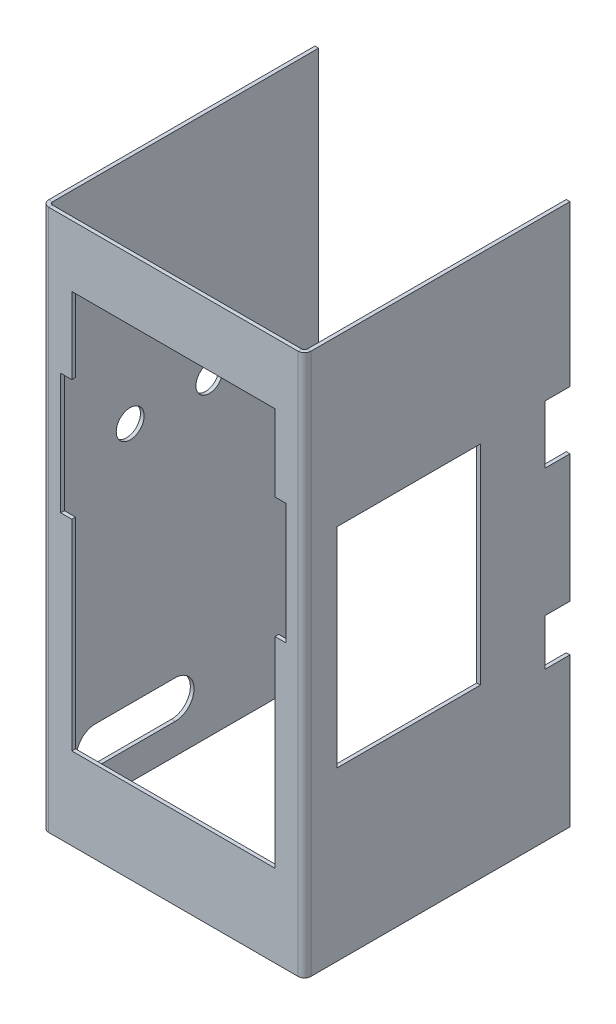
from build123d import *

# Parameters (mm, degrees)
BASE_FLANGE1_START             = -1
BASE_FLANGE1_OUTLINE_W         = 71
BASE_FLANGE1_OUTLINE_H         = 146.600550732
BASE_FLANGE1_DEPTH             = 1
EDGE_FLANGE1_STRIP_W           = 5.4732
EDGE_FLANGE1_STRIP_H           = 1
EDGE_FLANGE1_STRIP_CUT_DEPTH   = 146.600550732
EDGE_FLANGE1_STRIP_2_W         = 5.4732
EDGE_FLANGE1_STRIP_2_H         = 1
EDGE_FLANGE1_STRIP_CUT_2_DEPTH = 146.600550732
EDGE_FLANGE1_DEPTH             = 146.600550732
EDGE_FLANGE1_PROFILE_W         = 56.545302405
EDGE_FLANGE1_PROFILE_H         = 38.800406569
EDGE_FLANGE1_FLAT_DEPTH        = 1
EDGE_FLANGE1_BEND_DEPTH        = 146.600550732
EDGE_FLANGE1_PROFILE_2_W       = 146.600550732
EDGE_FLANGE1_PROFILE_2_H       = 72.095455735
EDGE_FLANGE1_PROFILE_2_R       = 3.775798506
EDGE_FLANGE1_PROFILE_2_R_2     = 3.613625218
EDGE_FLANGE1_FLAT_2_DEPTH      = 1


# Read off the part's stored shape, not the designer's step: Base-Flange1
# Sheet-metal steps are written as plain solids
with BuildPart() as part:
    # Base-Flange1 outline → Base-Flange1 (new body)
    with BuildSketch(Plane.XY.offset(BASE_FLANGE1_START)):
        Rectangle(BASE_FLANGE1_OUTLINE_W, BASE_FLANGE1_OUTLINE_H)
        Polygon((27.5, 56.679661992), (27.5, 35.987332772), (30.5, 35.987332772), (30.5, 3.276208649), (27.5, 3.276208649), (27.5, -51.054712488), (-27.5, -51.054712488), (-27.5, 3.276208649), (-30.5, 3.276208649), (-30.5, 35.987332772), (-27.5, 35.987332772), (-27.5, 56.679661992), align=None, mode=Mode.SUBTRACT)
    extrude(amount=BASE_FLANGE1_DEPTH)

    # Edge-Flange1 strip (across the edge) → Edge-Flange1 strip cut (cut)
    with BuildSketch(Plane(origin=(35.5, 73.300275366, -1), x_dir=(-1, 0, 0), z_dir=(0, -1, 0))):
        with Locations((-1, -0.5)):
            Rectangle(EDGE_FLANGE1_STRIP_W, EDGE_FLANGE1_STRIP_H)
    extrude(amount=EDGE_FLANGE1_STRIP_CUT_DEPTH, mode=Mode.SUBTRACT)

    # Edge-Flange1 strip 2 (across the edge) → Edge-Flange1 strip cut 2 (cut)
    with BuildSketch(Plane(origin=(-35.5, -73.300275366, -1), x_dir=(1, 0, 0), z_dir=(0, 1, 0))):
        with Locations((-1, -0.5)):
            Rectangle(EDGE_FLANGE1_STRIP_2_W, EDGE_FLANGE1_STRIP_2_H)
    extrude(amount=EDGE_FLANGE1_STRIP_CUT_2_DEPTH, mode=Mode.SUBTRACT)

    # Edge-Flange1 bend section (across the edge) → Edge-Flange1 (add)
    with BuildSketch(Plane(origin=(35.5, 73.300275366, -1), x_dir=(-1, 0, 0), z_dir=(0, -1, 0))):
        with BuildLine():
            Line((0, 0.7366), (1, 0.7366))
            ThreePointArc((1, 0.7366), (1.215745145, 0.215745145), (1.7366, 0))
            Line((1.7366, 0), (1.7366, -1))
            ThreePointArc((1.7366, -1), (0.508638364, -0.491361636), (0, 0.7366))
        make_face()
    extrude(amount=EDGE_FLANGE1_DEPTH)

    # Edge-Flange1 profile (on flange) → Edge-Flange1 flat (add)
    with BuildSketch(Plane(origin=(35.5, 0, -1), x_dir=(0, 1, 0), z_dir=(-1, 0, 0))):
        Polygon((-20.385230208, 70.874104098), (-20.385230208, 64.088111139), (-32.965566809, 64.088111139), (-32.965566809, 70.874104098), (-73.300275366, 70.874104098), (-73.300275366, 0.7366), (73.300275366, 0.7366), (73.300275366, 70.874104098), (29.936116194, 70.874104098), (29.936116194, 64.088111139), (14.177589294, 64.088111139), (14.177589294, 70.874104098), align=None)
        with Locations((0.339219033, 27.20786121)):
            Rectangle(EDGE_FLANGE1_PROFILE_W, EDGE_FLANGE1_PROFILE_H, mode=Mode.SUBTRACT)
    extrude(amount=EDGE_FLANGE1_FLAT_DEPTH)

    # Edge-Flange1 bend section 2 (across the edge) → Edge-Flange1 bend (add)
    with BuildSketch(Plane(origin=(-35.5, -73.300275366, -1), x_dir=(1, 0, 0), z_dir=(0, 1, 0))):
        with BuildLine():
            Line((0, 0.7366), (1, 0.7366))
            ThreePointArc((1, 0.7366), (1.215745145, 0.215745145), (1.7366, 0))
            Line((1.7366, 0), (1.7366, -1))
            ThreePointArc((1.7366, -1), (0.508638364, -0.491361636), (0, 0.7366))
        make_face()
    extrude(amount=EDGE_FLANGE1_BEND_DEPTH)

    # Edge-Flange1 profile 2 (on flange) → Edge-Flange1 flat 2 (add)
    with BuildSketch(Plane(origin=(-35.5, 0, -1), x_dir=(0, -1, 0), z_dir=(1, 0, 0))):
        with Locations((0, 36.784327868)):
            Rectangle(EDGE_FLANGE1_PROFILE_2_W, EDGE_FLANGE1_PROFILE_2_H)
        with BuildLine():
            ThreePointArc((65.114919352, 12.382584554), (60.007866854, 7.275532056), (54.900814356, 12.382584554))
            Line((54.900814356, 12.382584554), (54.900814356, 33.989345124))
            ThreePointArc((54.900814356, 33.989345124), (60.007866854, 39.096397622), (65.114919352, 33.989345124))
            Line((65.114919352, 33.989345124), (65.114919352, 12.382584554))
        make_face(mode=Mode.SUBTRACT)
        with Locations((-10.748889417, 21.810989166)):
            Circle(EDGE_FLANGE1_PROFILE_2_R, mode=Mode.SUBTRACT)
        with Locations((-10.748889417, 43.22132464)):
            Circle(EDGE_FLANGE1_PROFILE_2_R_2, mode=Mode.SUBTRACT)
    extrude(amount=EDGE_FLANGE1_FLAT_2_DEPTH)


solid = part.part
